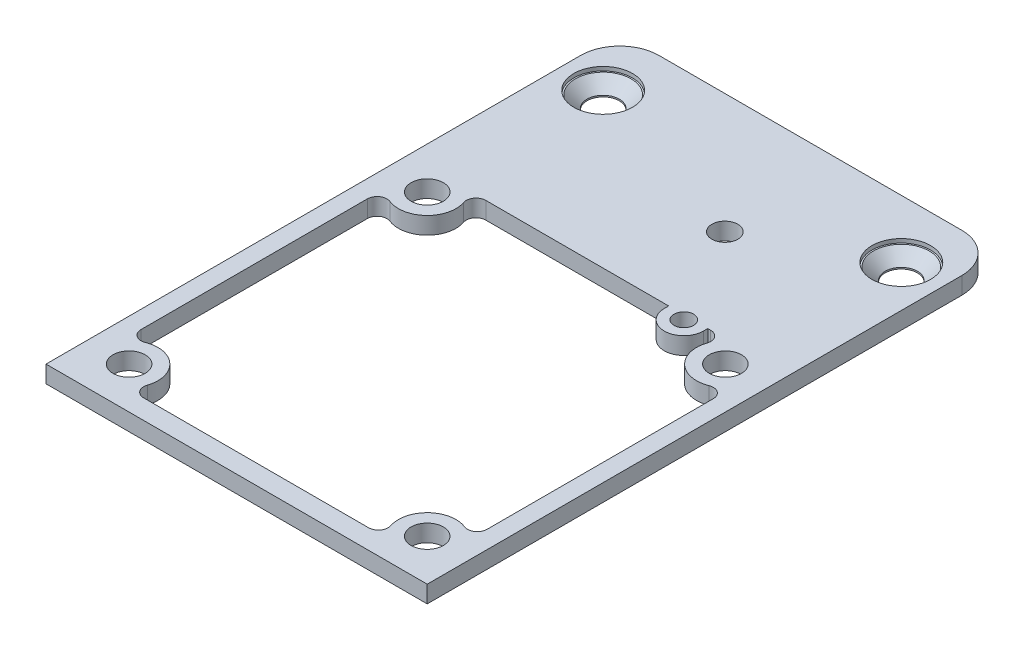
from build123d import *

# Parameters (mm, degrees)
SKETCH1_R               = 1.65
SKETCH1_R_2             = 1.33
SKETCH1_R_3             = 1
BASE_SHAPE_DEPTH        = 1.75
MILLING_FILLETS_R       = 1
SKETCH3_R               = 3
SCREW_HEAD_CUT_DEPTH    = 0.4
SCREW_HEAD_CHAMFER_SIZE = 1.2


with BuildPart() as part:
    # Sketch1 → Base shape (new body)
    with BuildSketch(Plane(origin=(0, 0, 0), x_dir=(1, 0, 0), z_dir=(0, 1, 0))):
        with BuildLine():
            Line((15.5, 39.2), (-15.5, 39.2))
            ThreePointArc((-15.5, 39.2), (-18.328427125, 38.028427125), (-19.5, 35.2))
            Line((-19.5, 35.2), (-19.5, -19.5))
            Line((-19.5, -19.5), (19.5, -19.5))
            Line((19.5, -19.5), (19.5, 35.2))
            ThreePointArc((19.5, 35.2), (18.328427125, 38.028427125), (15.5, 39.2))
        make_face()
        with BuildLine():
            Line((17.7, 13.606832327), (17.7, -13.606832327))
            ThreePointArc((17.7, -13.606832327), (13.284874461, -13.049822367), (13.341630288, -17.499583304))
            Line((13.341630288, -17.499583304), (-13.341630288, -17.499583304))
            ThreePointArc((-13.341630288, -17.499583304), (-13.284874461, -13.049822367), (-17.7, -13.606832327))
            Line((-17.7, -13.606832327), (-17.7, 13.606832327))
            ThreePointArc((-17.7, 13.606832327), (-13.284874461, 13.049822367), (-13.341630288, 17.499583304))
            Line((-13.341630288, 17.499583304), (7.2, 17.499583304))
            Line((7.2, 17.499583304), (7.2, 17.05))
            ThreePointArc((7.2, 17.05), (9.2, 15.05), (11.2, 17.05))
            Line((11.2, 17.05), (11.2, 17.499583304))
            Line((11.2, 17.499583304), (13.341630288, 17.499583304))
            ThreePointArc((13.341630288, 17.499583304), (13.284874461, 13.049822367), (17.7, 13.606832327))
        make_face(mode=Mode.SUBTRACT)
        with Locations((-15.25, 33.25)):
            Circle(SKETCH1_R, mode=Mode.SUBTRACT)
        with Locations((3.5, 26.95)):
            Circle(SKETCH1_R_2, mode=Mode.SUBTRACT)
        with Locations((15.25, 33.25)):
            Circle(SKETCH1_R, mode=Mode.SUBTRACT)
        with Locations((9.2, 17.05)):
            Circle(SKETCH1_R_3, mode=Mode.SUBTRACT)
        with Locations((15.25, -15.25)):
            Circle(SKETCH1_R, mode=Mode.SUBTRACT)
        with Locations((15.25, 15.25)):
            Circle(SKETCH1_R, mode=Mode.SUBTRACT)
        with Locations((-15.25, 15.25)):
            Circle(SKETCH1_R, mode=Mode.SUBTRACT)
        with Locations((-15.25, -15.25)):
            Circle(SKETCH1_R, mode=Mode.SUBTRACT)
    extrude(amount=BASE_SHAPE_DEPTH)

    # Milling fillets
    milling_fillets_edges = [part.edges().sort_by_distance(p)[0] for p in [
        (-17.7, 0.875, 13.606832327),
        (-13.341630288, 0.875, 17.499583304),
        (13.341630288, 0.875, 17.499583304),
        (17.7, 0.875, 13.606832327),
        (17.7, 0.875, -13.606832327),
        (13.341630288, 0.875, -17.499583304),
        (-13.341630288, 0.875, -17.499583304),
        (-17.7, 0.875, -13.606832327),
    ]]
    fillet(milling_fillets_edges, radius=MILLING_FILLETS_R)

    # Sketch3 → Screw head cut (cut)
    with BuildSketch(Plane(origin=(0, 1.75, 0), x_dir=(1, 0, 0), z_dir=(0, 1, 0))):
        with Locations((-15.25, 33.25)):
            Circle(SKETCH3_R)
        with Locations((15.25, 33.25)):
            Circle(SKETCH3_R)
    extrude(amount=-SCREW_HEAD_CUT_DEPTH, mode=Mode.SUBTRACT)

    # Screw head chamfer
    screw_head_chamfer_edges = [part.edges().sort_by_distance(p)[0] for p in [
        (13.6, 1.35, -33.25),
        (-16.9, 1.35, -33.25),
    ]]
    chamfer(screw_head_chamfer_edges, length=SCREW_HEAD_CHAMFER_SIZE)


solid = part.part
